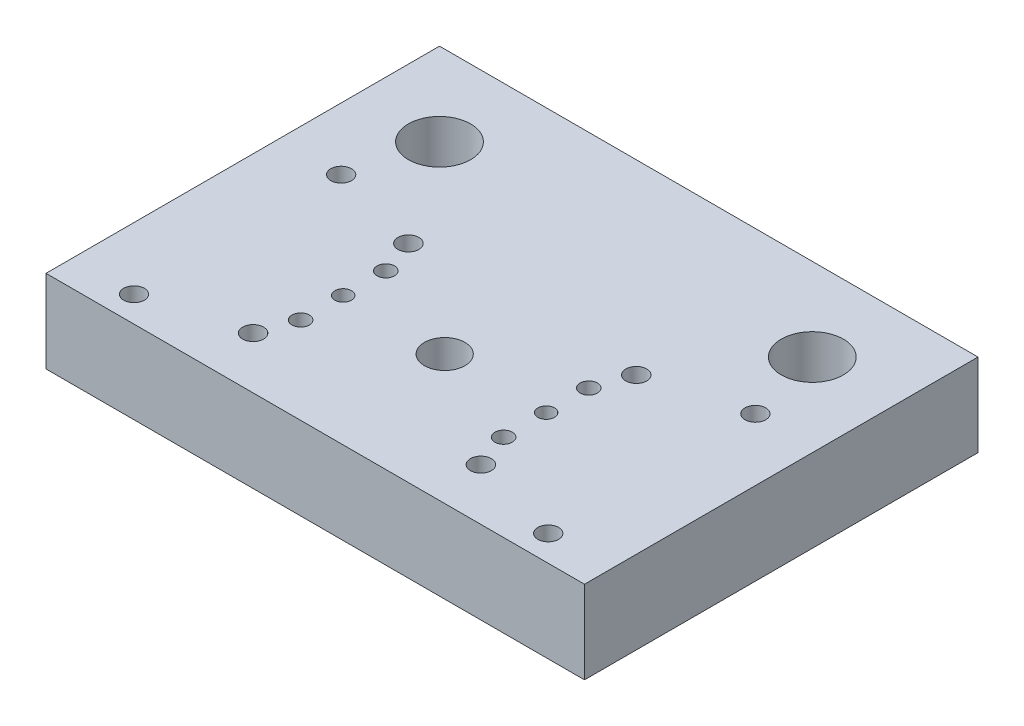
from build123d import *

# Parameters (mm, degrees)
SKETCH1_W                                           = 260
SKETCH1_H                                           = 190
BOSS_EXTRUDE1_DEPTH                                 = 40
SKETCH2_R                                           = 15
CUT_EXTRUDE1_DEPTH                                  = 166.90660023
SKETCH3_R                                           = 5.05
CUT_EXTRUDE2_DEPTH                                  = 166.90660023
SKETCH4_R                                           = 9.770548986
CUT_EXTRUDE3_DEPTH                                  = 166.90660023
CBORE_FOR_M8_HEX_SOCKET_HEAD_CAP_SCREW1_D           = 8.4
CBORE_FOR_M8_HEX_SOCKET_HEAD_CAP_SCREW1_CBORE_D     = 15
CBORE_FOR_M8_HEX_SOCKET_HEAD_CAP_SCREW1_CBORE_DEPTH = 8.6
F_8_0MM_DOWEL_HOLE1_D                               = 8
F_10_0MM_DOWEL_HOLE1_D                              = 10
SKETCH15_R                                          = 8.5
CUT_EXTRUDE4_DEPTH                                  = 31.9


with BuildPart() as part:
    # Sketch1 → Boss-Extrude1 (new body)
    with BuildSketch(Plane(origin=(0, 0, 0), x_dir=(1, 0, 0), z_dir=(0, 1, 0))):
        Rectangle(SKETCH1_W, SKETCH1_H)
    extrude(amount=-BOSS_EXTRUDE1_DEPTH)

    # Sketch2 → Cut-Extrude1 (cut, through all)
    with BuildSketch(Plane(origin=(0, 0, 0), x_dir=(1, 0, 0), z_dir=(0, 1, 0))):
        with Locations((-90, 55)):
            Circle(SKETCH2_R)
        with Locations((90, 55)):
            Circle(SKETCH2_R)
    extrude(amount=-CUT_EXTRUDE1_DEPTH, mode=Mode.SUBTRACT)

    # Sketch3 → Cut-Extrude2 (cut, through all)
    with BuildSketch(Plane.XZ.offset(40)):
        with Locations((-55, 70)):
            Circle(SKETCH3_R)
        with Locations((55, 70)):
            Circle(SKETCH3_R)
        with Locations((55, -5)):
            Circle(SKETCH3_R)
        with Locations((-55, -5)):
            Circle(SKETCH3_R)
    extrude(amount=-CUT_EXTRUDE2_DEPTH, mode=Mode.SUBTRACT)

    # Sketch4 → Cut-Extrude3 (cut, through all)
    with BuildSketch(Plane.XZ.offset(40)):
        with Locations((0, 32.5)):
            Circle(SKETCH4_R)
    extrude(amount=-CUT_EXTRUDE3_DEPTH, mode=Mode.SUBTRACT)

    # CBORE for M8 Hex Socket Head Cap Screw1 (through all)
    with Locations(Plane(origin=(0, -40, 0), x_dir=(-1, 0, 0), z_dir=(0, -1, 0))):
        with Locations((-49, -11.95), (-49, -53.05), (49, -53.05), (49, -11.95)):
            CounterBoreHole(CBORE_FOR_M8_HEX_SOCKET_HEAD_CAP_SCREW1_D / 2, CBORE_FOR_M8_HEX_SOCKET_HEAD_CAP_SCREW1_CBORE_D / 2, CBORE_FOR_M8_HEX_SOCKET_HEAD_CAP_SCREW1_CBORE_DEPTH)

    # Ø8.0mm Dowel Hole1 (through all)
    with Locations(Plane(origin=(0, -40, 0), x_dir=(-1, 0, 0), z_dir=(0, -1, 0))):
        with Locations((-49, -32.5), (49, -32.5)):
            Hole(F_8_0MM_DOWEL_HOLE1_D / 2)

    # Ø10.0mm Dowel Hole1 (through all)
    with Locations(Plane(origin=(0, -40, 0), x_dir=(-1, 0, 0), z_dir=(0, -1, 0))):
        with Locations((-100, 17.5), (-100, -82.5), (100, -82.5), (100, 17.5)):
            Hole(F_10_0MM_DOWEL_HOLE1_D / 2)

    # Sketch15 → Cut-Extrude4 (cut)
    with BuildSketch(Plane.XZ.offset(40)):
        with Locations((-100, 82.5)):
            Circle(SKETCH15_R)
        with Locations((100, 82.5)):
            Circle(SKETCH15_R)
        with Locations((100, -17.5)):
            Circle(SKETCH15_R)
        with Locations((-100, -17.5)):
            Circle(SKETCH15_R)
    extrude(amount=-CUT_EXTRUDE4_DEPTH, mode=Mode.SUBTRACT)


solid = part.part
